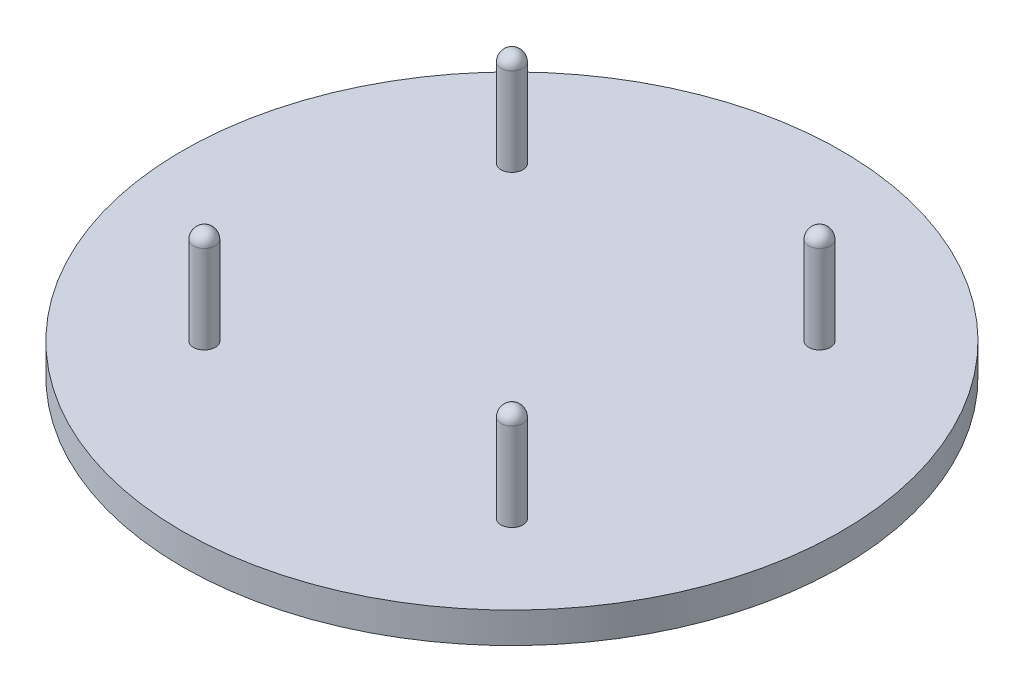
from build123d import *

# Parameters (mm, degrees)
SKETCH1_R           = 75
BOSS_EXTRUDE1_DEPTH = 7
SKETCH2_R           = 2.5
BOSS_EXTRUDE2_DEPTH = 20
CIRPATTERN1_COUNT   = 4
CIRPATTERN3_COUNT   = 4


# Read off the part's stored shape, not the designer's step: Dome1
with BuildPart() as part:
    # Sketch1 → Boss-Extrude1 (new body)
    with BuildSketch(Plane(origin=(0, 0, 0), x_dir=(1, 0, 0), z_dir=(0, 1, 0))):
        with Locations(Location((0, 0, 0), (0, 0, 270))):
            Circle(SKETCH1_R)
    extrude(amount=BOSS_EXTRUDE1_DEPTH)

    # Sketch2 → Boss-Extrude2 (add)
    with BuildSketch(Plane(origin=(0, 7, 0), x_dir=(1, 0, 0), z_dir=(0, 1, 0))):
        with Locations(Location((35, 35, 0), (0, 0, 270))):
            Circle(SKETCH2_R)
    boss_extrude2 = extrude(amount=BOSS_EXTRUDE2_DEPTH)

    # CirPattern1: Boss-Extrude2 ×4 about axis
    cirpattern1_axis = Axis((0, 0, 0), (0, 1, 0))
    for i in range(1, CIRPATTERN1_COUNT):
        add(boss_extrude2.rotate(cirpattern1_axis, i * 360 / CIRPATTERN1_COUNT))

    # Dome1 outline → Dome1 (revolve)
    with BuildSketch(Plane(origin=(-35, 0, -35), x_dir=(1, 0, 0), z_dir=(0, 0, 1))):
        with BuildLine():
            Line((0, 27), (2.5, 26.999999997))
            ThreePointArc((2.5, 26.999999997), (1.767766954, 28.767766952), (0, 29.5))
            Line((0, 29.5), (0, 27))
        make_face()
    dome1 = revolve(axis=Axis((-35, 0, -35), (0, 1, 0)))

    # CirPattern3: Dome1 ×4 about axis
    cirpattern3_axis = Axis((0, 0, 0), (0, 1, 0))
    for i in range(1, CIRPATTERN3_COUNT):
        add(dome1.rotate(cirpattern3_axis, i * 360 / CIRPATTERN3_COUNT))


solid = part.part
